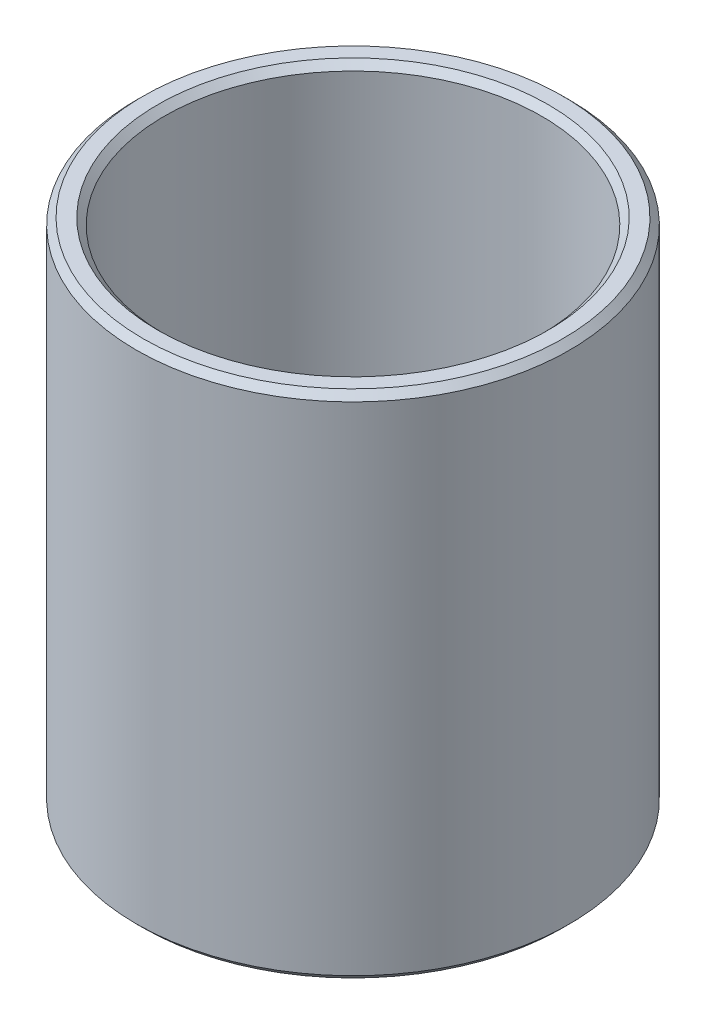
from build123d import *

# Parameters (mm, degrees)
SKETCH1_R           = 37.5
BOSS_EXTRUDE1_DEPTH = 88.316612847
SKETCH2_R           = 32.660673102
CUT_EXTRUDE1_DEPTH  = 104.016135167
CHAMFER1_SIZE       = 1.149774866


with BuildPart() as part:
    # Sketch1 → Boss-Extrude1 (new body)
    with BuildSketch(Plane(origin=(0, 0, 0), x_dir=(1, 0, 0), z_dir=(0, 1, 0))):
        Circle(SKETCH1_R)
    extrude(amount=BOSS_EXTRUDE1_DEPTH)

    # Sketch2 → Cut-Extrude1 (cut, through all)
    with BuildSketch(Plane(origin=(0, 0, 0), x_dir=(1, 0, 0), z_dir=(0, 1, 0))):
        Circle(SKETCH2_R)
    extrude(amount=CUT_EXTRUDE1_DEPTH, mode=Mode.SUBTRACT)

    # Chamfer1
    chamfer1_edges = [part.edges().sort_by_distance(p)[0] for p in [
        (-32.660673102, 88.316612847, 0),
        (-32.660673102, 0, 0),
        (-37.5, 0, 0),
        (-37.5, 88.316612847, 0),
    ]]
    chamfer(chamfer1_edges, length=CHAMFER1_SIZE)


solid = part.part
